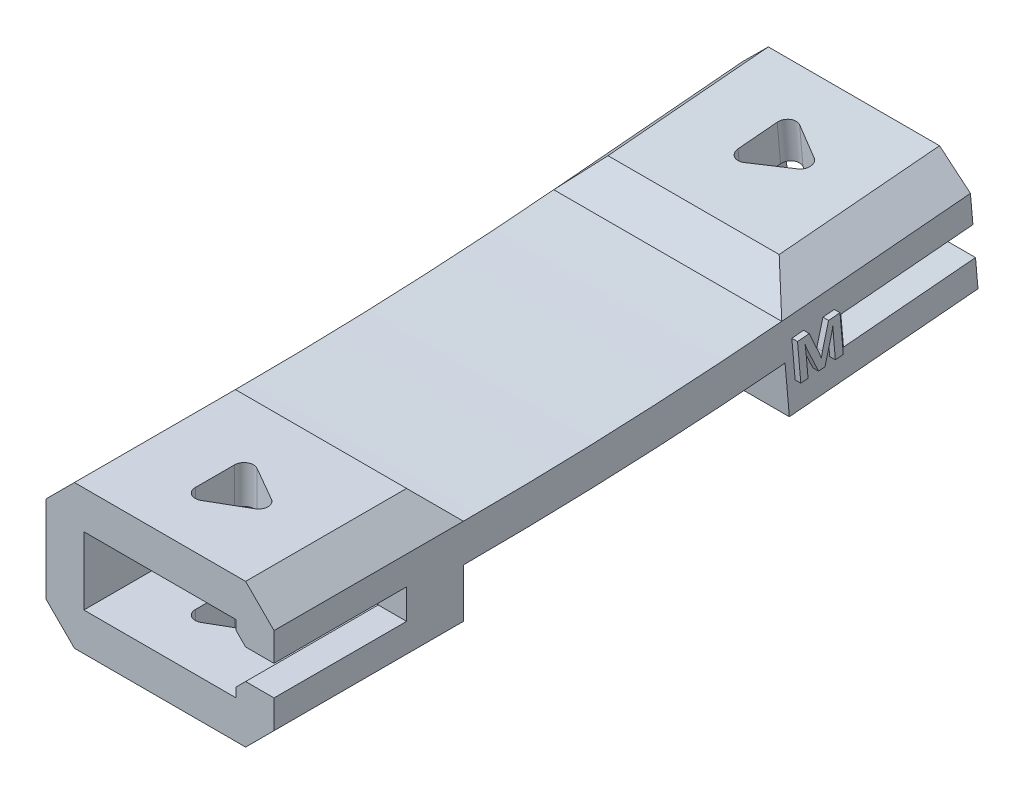
from build123d import *

# Parameters (mm, degrees)
SKETCH1_W               = 12.04
SKETCH1_H               = 7.58
SKETCH1_W_2             = 8.04
SKETCH1_H_2             = 3.58
BOSS_EXTRUDE1_DEPTH     = 8
SKETCH1_2_W             = 12.04
SKETCH1_2_H             = 7.58
SKETCH1_2_W_2           = 8.04
SKETCH1_2_H_2           = 3.58
BOSS_EXTRUDE2_DEPTH     = 2
EXTRUDE_THIN1_START     = -12.04
EXTRUDE_THIN1_DEPTH     = 12.04
SKETCH5_W               = 12.04
SKETCH5_H               = 7.58
SKETCH5_W_2             = 8.04
SKETCH5_H_2             = 3.58
BOSS_EXTRUDE4_DEPTH     = 10
SKETCH5_4_W             = 12.04
SKETCH5_4_H             = 7.58
BOSS_EXTRUDE5_DEPTH     = 2
CHAMFER1_SIZE           = 1.5
CUT_EXTRUDE1_DEPTH      = 31.858817668
CUT_EXTRUDE1_DEPTH_BACK = 31.858817668
CUT_EXTRUDE2_DEPTH      = 31.883619629
CUT_EXTRUDE2_DEPTH_BACK = 31.883619629
SKETCH8_W               = 4
SKETCH8_H               = 1.58
CUT_EXTRUDE3_DEPTH      = 7
SKETCH9_W               = 4
SKETCH9_H               = 1.58
CUT_EXTRUDE4_DEPTH      = 7
CHAMFER2_SIZE           = 0.5
BOSS_EXTRUDE6_DEPTH     = 0.3


with BuildPart() as part:
    # Sketch1 → Boss-Extrude1 (new body)
    with BuildSketch(Plane.XY):
        Rectangle(SKETCH1_W, SKETCH1_H)
        Rectangle(SKETCH1_W_2, SKETCH1_H_2, mode=Mode.SUBTRACT)
    extrude(amount=BOSS_EXTRUDE1_DEPTH)

    # Sketch1<2> → Boss-Extrude2 (add)
    # profile 1 of 2: a face of its own
    with BuildSketch(Plane.XY):
        Rectangle(SKETCH1_2_W, SKETCH1_2_H)
        Rectangle(SKETCH1_2_W_2, SKETCH1_2_H_2, mode=Mode.SUBTRACT)
    # profile 2 of 2: a face of its own
    with BuildSketch(Plane.XY):
        Rectangle(SKETCH1_2_W_2, SKETCH1_2_H_2)
    extrude(amount=-BOSS_EXTRUDE2_DEPTH)

    # Sketch3 → Extrude-Thin1 (add)
    with BuildSketch(Plane(origin=(6.02, 9.81, 0), x_dir=(0, -1, 0), z_dir=(1, 0, 0)).offset(EXTRUDE_THIN1_START)):
        with BuildLine():
            Line((13.6, 2), (9.52, 2))
            ThreePointArc((9.52, 2), (9.33452957, 10.5), (8.778471331, 18.983819807))
            Line((8.778471331, 18.983819807), (12.842945699, 19.339415237))
            Line((12.842945699, 19.339415237), (12.668634214, 21.331804633))
            Line((12.668634214, 21.331804633), (6.601440048, 20.800993925))
            ThreePointArc((6.601440048, 20.800993925), (7.336433126, 10.412761225), (7.509629919, 0))
            Line((7.509629919, 0), (13.6, 0))
            Line((13.6, 0), (13.6, 2))
        make_face()
    extrude(amount=EXTRUDE_THIN1_DEPTH)

    # Sketch5 → Boss-Extrude4 (add)
    with BuildSketch(Plane(origin=(0, -2.094837633, -19.257341416), x_dir=(-1, 0, 0), z_dir=(0, 0.08715574274765182, -0.9961946980917462))):
        with Locations((0, 2.848308513)):
            Rectangle(SKETCH5_W, SKETCH5_H)
        with Locations((0, 2.848308513)):
            Rectangle(SKETCH5_W_2, SKETCH5_H_2, mode=Mode.SUBTRACT)
    extrude(amount=BOSS_EXTRUDE4_DEPTH)

    # Sketch5<4> → Boss-Extrude5 (add)
    with BuildSketch(Plane(origin=(0, -2.094837633, -19.257341416), x_dir=(-1, 0, 0), z_dir=(0, 0.08715574274765182, -0.9961946980917462))):
        with Locations((0, 2.848308513)):
            Rectangle(SKETCH5_4_W, SKETCH5_4_H)
    extrude(amount=BOSS_EXTRUDE5_DEPTH)

    # Chamfer1
    chamfer1_edges = [part.edges().sort_by_distance(p)[0] for p in [
        (0, -3.79, -2),
        (0, 3.79, -2),
        (-6.02, -2.597166986, -24.320388728),
        (6.02, -2.597166986, -24.320388728),
        (0, -3.032945699, -19.339415237),
        (6.02, -3.79, 3),
        (-6.02, -3.79, 3),
        (-6.02, 3.79, 3),
        (6.02, 3.79, 3),
        (0, 4.518210112, -18.678774707),
        (6.02, 4.953988826, -23.659748198),
        (-6.02, 4.953988826, -23.659748198),
    ]]
    chamfer(chamfer1_edges, length=CHAMFER1_SIZE - 0.0001)  # a hair under: the kernel refuses the full size

    # Sketch6 → Cut-Extrude1 (cut, two sides: drawn at the far end of the back side and taken through both)
    with BuildSketch(Plane(origin=(0, 3.79, 0), x_dir=(1, 0, 0), z_dir=(0, 1, 0)).offset(-CUT_EXTRUDE1_DEPTH_BACK)):
        with BuildLine():
            Line((1.45, -3.566987298), (-0.35, -2.527756814))
            ThreePointArc((-0.35, -2.527756814), (-0.85, -2.527756814), (-1.1, -2.960769515))
            Line((-1.1, -2.960769515), (-1.1, -5.039230485))
            ThreePointArc((-1.1, -5.039230485), (-0.85, -5.472243186), (-0.35, -5.472243186))
            Line((-0.35, -5.472243186), (1.45, -4.433012702))
            ThreePointArc((1.45, -4.433012702), (1.7, -4), (1.45, -3.566987298))
        make_face()
    extrude(amount=CUT_EXTRUDE1_DEPTH + CUT_EXTRUDE1_DEPTH_BACK, mode=Mode.SUBTRACT)

    # Sketch7 → Cut-Extrude2 (cut, two sides: drawn at the far end of the back side and taken through both)
    with BuildSketch(Plane(origin=(0, 2.862121636, 0.250403197), x_dir=(1, 0, 0), z_dir=(0, 0.9961946980917462, 0.08715574274765181)).offset(-CUT_EXTRUDE2_DEPTH_BACK)):
        with BuildLine():
            Line((1.45, 25.43449699), (-0.35, 26.473727475))
            ThreePointArc((-0.35, 26.473727475), (-0.85, 26.473727475), (-1.1, 26.040714773))
            Line((-1.1, 26.040714773), (-1.1, 23.962253804))
            ThreePointArc((-1.1, 23.962253804), (-0.85, 23.529241102), (-0.35, 23.529241102))
            Line((-0.35, 23.529241102), (1.45, 24.568471587))
            ThreePointArc((1.45, 24.568471587), (1.7, 25.001484288), (1.45, 25.43449699))
        make_face()
    extrude(amount=CUT_EXTRUDE2_DEPTH + CUT_EXTRUDE2_DEPTH_BACK, mode=Mode.SUBTRACT)

    # Sketch8 → Cut-Extrude3 (cut)
    with BuildSketch(Plane(origin=(0, 2.527645904, -28.891124885), x_dir=(-1, 0, 0), z_dir=(0, 0.08715574274765193, -0.9961946980917461))):
        with Locations((-6.02, -0.916945525)):
            Rectangle(SKETCH8_W, SKETCH8_H)
    extrude(amount=-CUT_EXTRUDE3_DEPTH, mode=Mode.SUBTRACT)

    # Sketch9 → Cut-Extrude4 (cut)
    with BuildSketch(Plane.XY.offset(8)):
        with Locations((6.02, 0)):
            Rectangle(SKETCH9_W, SKETCH9_H)
    extrude(amount=-CUT_EXTRUDE4_DEPTH, mode=Mode.SUBTRACT)

    # Chamfer2
    chamfer2_edges = [part.edges().sort_by_distance(p)[0] for p in [
        (4.02, 0.522150723, -25.553213547),
        (4.02, 1.004099435, -21.997679067),
        (4.02, 2.096138346, -25.415507473),
        (4.02, 0.79, 4.5),
        (4.02, 0, 1),
        (4.02, -0.79, 4.5),
    ]]
    chamfer(chamfer2_edges, length=CHAMFER2_SIZE)

    # Sketch10 → Boss-Extrude6 (add)
    with BuildSketch(Plane(origin=(6.02, 0, 0), x_dir=(0, 0, -1), z_dir=(1, 0, 0))):
        with BuildLine():
            Line((21.338592032, 0.15320422), (21.233028007, 1.362426781))
            add(Edge.make_bspline(
                [(21.233028007, 1.362426781), (21.230623172, 1.392016851), (21.22550753, 1.454961769), (21.219940858, 1.554962176), (21.215964545, 1.666017285), (21.21390718, 1.743649504), (21.212829837, 1.784301781)],
                knots=[0, 0, 0, 0, 0.843314449, 1.793924683, 2.844783983, 4, 4, 4, 4], degree=3))
            Line((21.212829837, 1.784301781), (21.202540203, 1.783539585))
            add(Edge.make_bspline(
                [(21.202540203, 1.783539585), (21.200808847, 1.76790896), (21.197498896, 1.738026826), (21.192026096, 1.695375149), (21.187181442, 1.656725646), (21.182258815, 1.622035938), (21.177293915, 1.591439333), (21.172767869, 1.564856175), (21.168316369, 1.542328609), (21.164861999, 1.528700708), (21.163287154, 1.522487756)],
                knots=[0, 0, 0, 0, 1.428769924, 2.731477, 3.906784307, 4.967723303, 5.914548028, 6.722864751, 7.417754754, 8, 8, 8, 8], degree=3))
            Line((21.163287154, 1.522487756), (20.792098129, 0.105567024))
            Line((20.792098129, 0.105567024), (20.453683495, 0.075841415))
            Line((20.453683495, 0.075841415), (19.837067642, 1.393295683))
            add(Edge.make_bspline(
                [(19.837067642, 1.393295683), (19.835006874, 1.398111338), (19.83016149, 1.409434157), (19.822671636, 1.429138703), (19.813894021, 1.454208796), (19.803667873, 1.484424749), (19.792311733, 1.520061222), (19.779237689, 1.560762892), (19.765280196, 1.6069604), (19.755390982, 1.639486413), (19.750177398, 1.656634098)],
                knots=[0, 0, 0, 0, 0.453127431, 1.065416844, 1.823166036, 2.751085321, 3.825012516, 5.058876589, 6.449442438, 8, 8, 8, 8], degree=3))
            Line((19.750177398, 1.656634098), (19.738744471, 1.655490805))
            add(Edge.make_bspline(
                [(19.738744471, 1.655490805), (19.751035456, 1.572245864), (19.77562146, 1.405728657), (19.791432277, 1.238150394), (19.799338983, 1.154347512)],
                knots=[0, 0, 0, 0, 0.999835902, 2, 2, 2, 2], degree=3))
            Line((19.799338983, 1.154347512), (19.898043251, 0.027442024))
            Line((19.898043251, 0.027442024), (19.514659105, -0.006094561))
            Line((19.514659105, -0.006094561), (19.34049752, 1.986283488))
            Line((19.34049752, 1.986283488), (19.957875568, 2.040018244))
            Line((19.957875568, 2.040018244), (20.492555446, 0.873859707))
            add(Edge.make_bspline(
                [(20.492555446, 0.873859707), (20.503235644, 0.85021375), (20.524164125, 0.803878095), (20.550400132, 0.734093054), (20.573588848, 0.666711186), (20.584949885, 0.621787137), (20.59049752, 0.599850561)],
                knots=[0, 0, 0, 0, 1.068017297, 2.092843245, 3.068728431, 4, 4, 4, 4], degree=3))
            Line((20.59049752, 0.599850561), (20.599262764, 0.600612756))
            add(Edge.make_bspline(
                [(20.599262764, 0.600612756), (20.603575304, 0.627567148), (20.611930591, 0.679789657), (20.62621702, 0.755074943), (20.640290752, 0.825113193), (20.651436457, 0.869577883), (20.656808495, 0.891009098)],
                knots=[0, 0, 0, 0, 1.106003676, 2.142815394, 3.104869014, 4, 4, 4, 4], degree=3))
            Line((20.656808495, 0.891009098), (20.983028007, 2.129957268))
            Line((20.983028007, 2.129957268), (21.583637764, 2.182548732))
            Line((21.583637764, 2.182548732), (21.757799349, 0.190170683))
            Line((21.757799349, 0.190170683), (21.338592032, 0.15320422))
        make_face()
    extrude(amount=BOSS_EXTRUDE6_DEPTH)


solid = part.part
